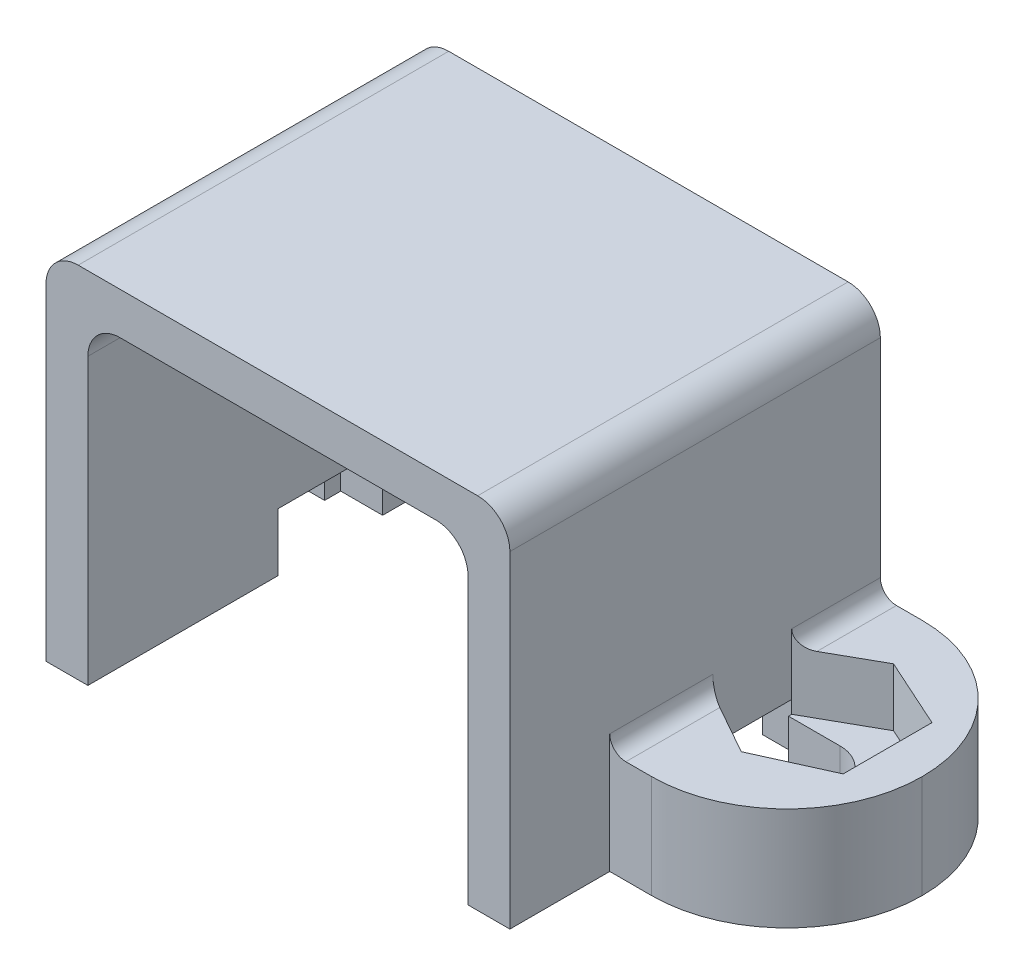
from build123d import *
from OCP.BRepFilletAPI import BRepFilletAPI_MakeFillet

# Parameters (mm, degrees)
BOSS_EXTRUDE1_DEPTH = 11.5
SKETCH1_3_W         = 5.5
SKETCH1_3_H         = 3.2
BOSS_EXTRUDE2_DEPTH = 8.4
CUT_EXTRUDE1_DEPTH  = 1.8
SKETCH5_3_W         = 2.721866022
SKETCH5_3_H         = 2.25
CUT_EXTRUDE2_DEPTH  = 29.993318196
FILLET1_R           = 4.2
FILLET1_R_2         = 1.125
FILLET1_R_3         = 1
FILLET1_R_4         = 0.5
CUT_EXTRUDE12_DEPTH = 1.8


with BuildPart() as part:
    # Sketch1 → Boss-Extrude1 (new body)
    with BuildSketch(Plane.XY):
        Polygon((5.5, 7.95), (5.5, 0), (5.5, -3.2), (6.8, -3.2), (6.8, 6.65), (12.7, 6.65), (12.7, 7.95), align=None)
        Polygon((19.9, 7.95), (12.7, 7.95), (12.7, 6.65), (18.6, 6.65), (18.6, -3.2), (19.9, -3.2), (19.9, 0), align=None)
    extrude(amount=BOSS_EXTRUDE1_DEPTH)

    # Sketch1<3> → Boss-Extrude2 (add)
    with BuildSketch(Plane.XY):
        with Locations((2.75, -1.6)):
            Rectangle(SKETCH1_3_W, SKETCH1_3_H)
        with Locations((22.65, -1.6)):
            Rectangle(SKETCH1_3_W, SKETCH1_3_H)
    extrude(amount=BOSS_EXTRUDE2_DEPTH)

    # Sketch5 → Cut-Extrude1 (cut)
    with BuildSketch(Plane(origin=(0, 0, 0), x_dir=(1, 0, 0), z_dir=(0, 1, 0))):
        Polygon((3.478202851, -1.61261316), (1.3, -2.596789569), (1.3, -5.354715804), (3.478202851, -6.338892213), (5.5, -5.201401594), (5.5, -5.100752687), (2.778133978, -5.100752687), (2.778133978, -2.850752687), (5.5, -2.850752687), (5.5, -2.750103779), align=None)
        Polygon((19.9, -5.100752687), (19.9, -5.201401594), (21.921797149, -6.338892213), (24.1, -5.354715804), (24.1, -2.596789569), (21.921797149, -1.61261316), (19.9, -2.750103779), (19.9, -2.850752687), (22.621866022, -2.850752687), (22.621866022, -5.100752687), align=None)
    extrude(amount=-CUT_EXTRUDE1_DEPTH, mode=Mode.SUBTRACT)

    # Sketch5<3> → Cut-Extrude2 (cut, through all)
    with BuildSketch(Plane(origin=(0, 0, 0), x_dir=(1, 0, 0), z_dir=(0, 1, 0))):
        Polygon((2.778133978, -2.850752687), (2.778133978, -3.975752687), (2.778133978, -5.100752687), (5.5, -5.100752687), (5.5, -2.850752687), align=None)
        with Locations((21.260933011, -3.975752687)):
            Rectangle(SKETCH5_3_W, SKETCH5_3_H)
    extrude(amount=-CUT_EXTRUDE2_DEPTH, mode=Mode.SUBTRACT)

    # Fillet1
    fillet1_edges_1 = [part.edges().sort_by_distance(p)[0] for p in [
        (0, -1.6, 0),
        (0, -1.6, 8.4),
        (25.4, -1.6, 8.4),
        (25.4, -1.6, 0),
    ]]
    fillet1_edges_2 = [part.edges().sort_by_distance(p)[0] for p in [
        (2.778133978, -2.5, 5.100752687),
        (2.778133978, -2.5, 2.850752687),
        (22.621866022, -2.5, 2.850752687),
        (22.621866022, -2.5, 5.100752687),
    ]]
    fillet1_edges_3 = [part.edges().sort_by_distance(p)[0] for p in [
        (5.5, 7.95, 5.75),
        (19.9, 7.95, 5.75),
        (18.6, 6.65, 5.75),
        (6.8, 6.65, 5.75),
    ]]
    fillet1_edges_4 = [part.edges().sort_by_distance(p)[0] for p in [
        (5.5, 0, 6.800700797),
        (19.9, 0, 6.800700797),
        (19.9, 0, 1.37505189),
        (5.5, 0, 1.37505189),
    ]]
    fillet1 = BRepFilletAPI_MakeFillet(part.part.solid().wrapped)
    for e in fillet1_edges_1:
        fillet1.Add(FILLET1_R - 0.0001, e.wrapped)
    for e in fillet1_edges_2:
        fillet1.Add(FILLET1_R_2 - 0.0001, e.wrapped)
    for e in fillet1_edges_3:
        fillet1.Add(FILLET1_R_3 - 0.0001, e.wrapped)
    for e in fillet1_edges_4:
        fillet1.Add(FILLET1_R_4 - 0.0001, e.wrapped)
    add(Compound.cast(fillet1.Shape()), mode=Mode.REPLACE)  # a hair under: the kernel refuses the full size

    # Sketch6 → Cut-Extrude12 (cut)
    with BuildSketch(Plane.XZ.offset(3.2)):
        Polygon((19.9, 5.100752687), (19.9, 2.850752687), (19.9, 2.350752687), (18.327658743, 2.350752687), (18.327658743, 5.600752687), (19.9, 5.600752687), align=None)
        Polygon((5.5, 5.600752687), (5.5, 5.100752687), (5.5, 2.850752687), (5.5, 2.350752687), (6.8, 2.350752687), (6.8, 5.600752687), align=None)
    extrude(amount=-CUT_EXTRUDE12_DEPTH, mode=Mode.SUBTRACT)


solid = part.part
